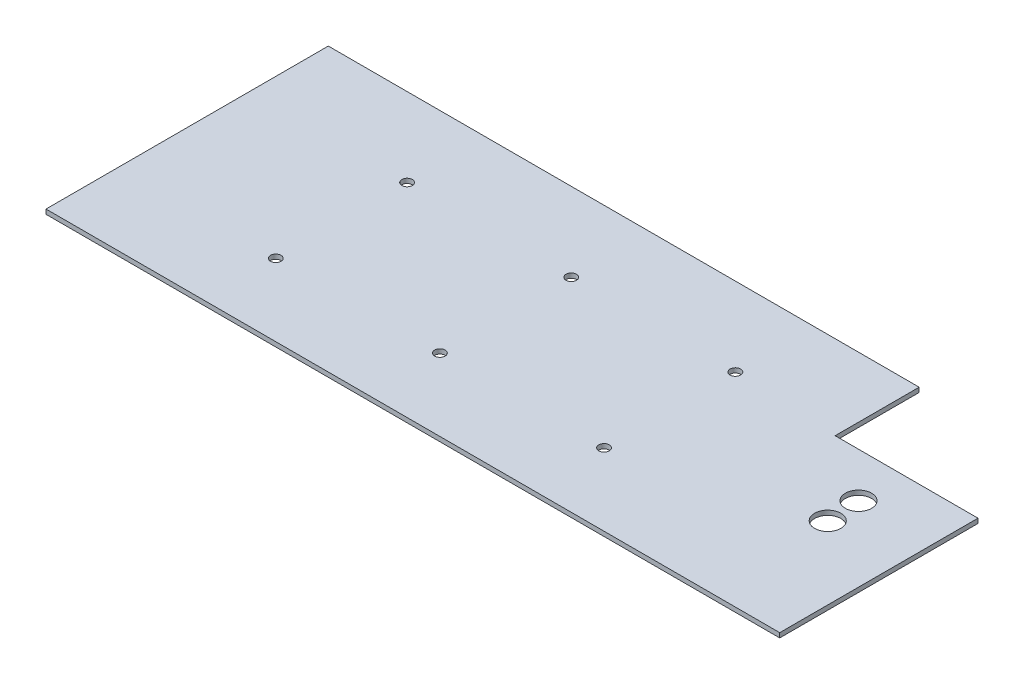
from build123d import *

# Parameters (mm, degrees)
BOSS_EXTRUDE1_DEPTH     = 3.5
CUT_EXTRUDE1_DEPTH      = 599.744260933
CUT_EXTRUDE1_DEPTH_BACK = 599.744260933
SKETCH2_R               = 4
SKETCH3_R               = 10
CUT_EXTRUDE2_DEPTH      = 10


with BuildPart() as part:
    # Sketch1 → Boss-Extrude1 (new body)
    with BuildSketch(Plane(origin=(0, 0, 0), x_dir=(1, 0, 0), z_dir=(0, 1, 0))):
        Polygon((0, 0), (0, 215), (450, 215), (450, 151), (558.8, 151), (558.8, 0), align=None)
    extrude(amount=BOSS_EXTRUDE1_DEPTH)

    # Sketch2 → Cut-Extrude1 (cut, two sides: drawn at the far end of the back side and taken through both)
    with BuildSketch(Plane(origin=(0, 3.5, 0), x_dir=(1, 0, 0), z_dir=(0, 1, 0)).offset(-CUT_EXTRUDE1_DEPTH_BACK)):
        with Locations((120, 155)):
            Circle(SKETCH2_R)
        with Locations((245, 155)):
            Circle(SKETCH2_R)
        with Locations((370, 155)):
            Circle(SKETCH2_R)
        with Locations((370, 55)):
            Circle(SKETCH2_R)
        with Locations((245, 55)):
            Circle(SKETCH2_R)
        with Locations((120, 55)):
            Circle(SKETCH2_R)
    extrude(amount=CUT_EXTRUDE1_DEPTH + CUT_EXTRUDE1_DEPTH_BACK, mode=Mode.SUBTRACT)

    # Sketch3 → Cut-Extrude2 (cut)
    with BuildSketch(Plane(origin=(0, 3.5, 0), x_dir=(1, 0, 0), z_dir=(0, 1, 0))):
        with Locations((501.8, 117)):
            Circle(SKETCH3_R)
        with Locations((503.315667462, 92.045987254)):
            Circle(SKETCH3_R)
    extrude(amount=-CUT_EXTRUDE2_DEPTH, mode=Mode.SUBTRACT)


solid = part.part
